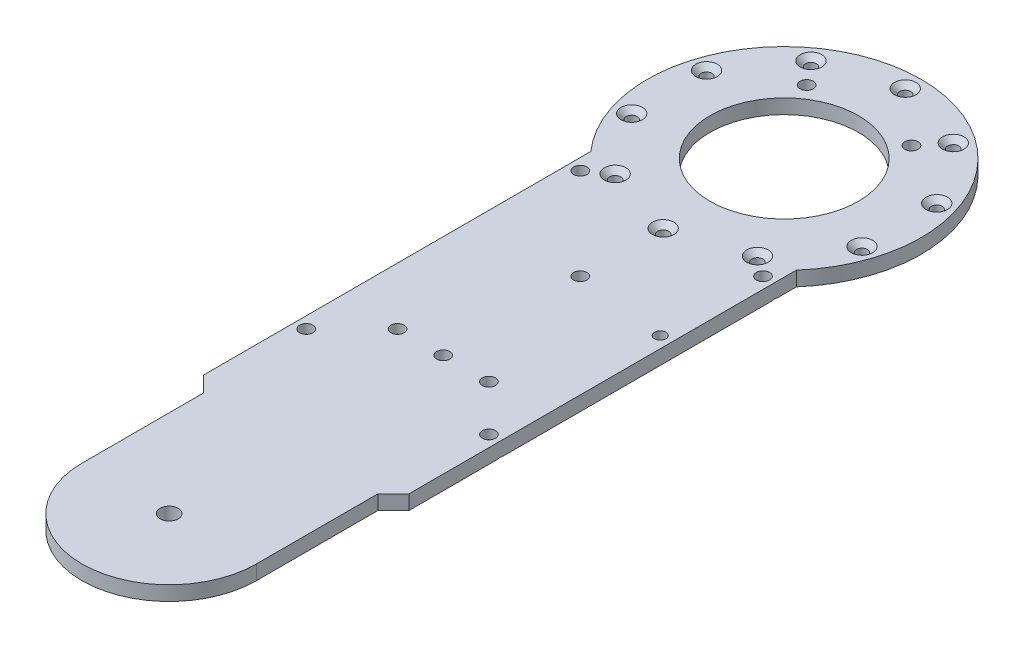
from build123d import *

# Parameters (mm, degrees)
BOSS_EXTRUDE1_DEPTH                             = 6.35
SKETCH2_R                                       = 2
SKETCH2_R_2                                     = 32.5
SKETCH2_R_3                                     = 4
SKETCH2_R_4                                     = 2.5
CUT_EXTRUDE1_DEPTH                              = 314.363323476
CHAMFER1_SIZE                                   = 10
CSK_FOR_M4_OVAL_HEAD_MACHINE_SCREW1_D           = 4.8
CSK_FOR_M4_OVAL_HEAD_MACHINE_SCREW1_CSINK_D     = 9.4
CSK_FOR_M4_OVAL_HEAD_MACHINE_SCREW1_CSINK_ANGLE = 90
CSK_FOR_M5_OVAL_HEAD_MACHINE_SCREW1_D           = 5.8
CSK_FOR_M5_OVAL_HEAD_MACHINE_SCREW1_CSINK_D     = 10.4
CSK_FOR_M5_OVAL_HEAD_MACHINE_SCREW1_CSINK_ANGLE = 90


with BuildPart() as part:
    # Sketch1 → Boss-Extrude1 (new body)
    with BuildSketch(Plane(origin=(0, 0, 0), x_dir=(1, 0, 0), z_dir=(0, 1, 0))):
        with BuildLine():
            Line((-45, -219.3), (-38.2, -219.3))
            Line((-38.2, -219.3), (-38.2, -269.3))
            ThreePointArc((-38.2, -269.3), (0, -307.5), (38.2, -269.3))
            Line((38.2, -269.3), (38.2, -219.3))
            Line((38.2, -219.3), (45, -219.3))
            Line((45, -219.3), (45, -39.686269666))
            ThreePointArc((45, -39.686269666), (0, 60), (-45, -39.686269666))
            Line((-45, -39.686269666), (-45, -219.3))
        make_face()
    extrude(amount=BOSS_EXTRUDE1_DEPTH)

    # Sketch2 → Cut-Extrude1 (cut, through all)
    with BuildSketch(Plane(origin=(0, 6.35, 0), x_dir=(1, 0, 0), z_dir=(0, 1, 0))):
        with Locations(Location((0, 53, 0), (0, 0, 270))):
            Circle(SKETCH2_R)
        with Locations(Location((31.152618372, 42.877900702, 0), (0, 0, 270))):
            Circle(SKETCH2_R)
        with Locations(Location((50.405995364, 16.377900702, 0), (0, 0, 270))):
            Circle(SKETCH2_R)
        with Locations(Location((50.405995364, -16.377900702, 0), (0, 0, 270))):
            Circle(SKETCH2_R)
        with Locations(Location((31.152618372, -42.877900702, 0), (0, 0, 270))):
            Circle(SKETCH2_R)
        with Locations(Location((0, -53, 0), (0, 0, 270))):
            Circle(SKETCH2_R)
        with Locations(Location((-31.152618371, -42.877900702, 0), (0, 0, 270))):
            Circle(SKETCH2_R)
        with Locations(Location((-50.405995364, -16.377900702, 0), (0, 0, 270))):
            Circle(SKETCH2_R)
        with Locations(Location((-50.405995364, 16.377900702, 0), (0, 0, 270))):
            Circle(SKETCH2_R)
        with Locations(Location((-31.152618371, 42.877900702, 0), (0, 0, 270))):
            Circle(SKETCH2_R)
        with Locations(Location((0, 0, 0), (0, 0, 270))):
            Circle(SKETCH2_R_2)
        with Locations(Location((0, -269.3, 0), (0, 0, 270))):
            Circle(SKETCH2_R_3)
        with Locations(Location((-40, -169.3, 0), (0, 0, 270))):
            Circle(SKETCH2_R_4)
        with Locations(Location((-40, -49.3, 0), (0, 0, 270))):
            Circle(SKETCH2_R_4)
        with Locations(Location((40, -169.3, 0), (0, 0, 90))):
            Circle(SKETCH2_R_4)
        with Locations(Location((40, -49.3, 0), (0, 0, 90))):
            Circle(SKETCH2_R_4)
        with Locations(Location((0, -89.3, 0), (0, 0, 270))):
            Circle(SKETCH2_R_4)
        with Locations(Location((-20, -149.3, 0), (0, 0, 270))):
            Circle(SKETCH2_R_4)
        with Locations(Location((0, -149.3, 0), (0, 0, 270))):
            Circle(SKETCH2_R_4)
        with Locations(Location((20, -149.3, 0), (0, 0, 270))):
            Circle(SKETCH2_R_4)
        with Locations(Location((-22.943057454, 32.766081772, 0), (0, 0, 270))):
            Circle(SKETCH2_R_4)
        with Locations(Location((22.943057454, 32.766081772, 0), (0, 0, 270))):
            Circle(SKETCH2_R_4)
        with Locations(Location((40, -94.3, 0), (0, 0, 270))):
            Circle(SKETCH2_R_4)
    extrude(amount=-CUT_EXTRUDE1_DEPTH, mode=Mode.SUBTRACT)

    # Chamfer1
    # the kernel refuses this chamfer: 10 mm, written as the material it takes off along each edge
    with BuildSketch(Plane(origin=(45, -25.71682988, 219.3), x_dir=(0.027495876610586282, 0, -0.9996219169112968), z_dir=(0, 1, 0))) as chamfer1_piece_1_section:
        Polygon((CHAMFER1_SIZE * 0.999621916911, CHAMFER1_SIZE * 0.0274958766106), (-CHAMFER1_SIZE * 0.0274958766106, CHAMFER1_SIZE * 0.999621916911), (0, 0), align=None)
    chamfer1_piece_1 = extrude(amount=57.783659759, mode=Mode.PRIVATE)
    chamfer1_piece_1 = split(chamfer1_piece_1, bisect_by=Plane(origin=(38.2, 3.175, 215.680305009), z_dir=(1, 0, 0)), keep=Keep.TOP, mode=Mode.PRIVATE)
    add(chamfer1_piece_1, mode=Mode.SUBTRACT)
    with BuildSketch(Plane(origin=(-45, -25.71682988, 219.3), x_dir=(-0.027495876610586282, 0, -0.9996219169112968), z_dir=(0, 1, 0))) as chamfer1_piece_2_section:
        Polygon((CHAMFER1_SIZE * 0.999621916911, -CHAMFER1_SIZE * 0.0274958766106), (-CHAMFER1_SIZE * 0.0274958766106, -CHAMFER1_SIZE * 0.999621916911), (0, 0), align=None)
    chamfer1_piece_2 = extrude(amount=57.783659759, mode=Mode.PRIVATE)
    chamfer1_piece_2 = split(chamfer1_piece_2, bisect_by=Plane(origin=(-38.2, 3.175, 215.680305009), z_dir=(-1, 0, 0)), keep=Keep.TOP, mode=Mode.PRIVATE)
    add(chamfer1_piece_2, mode=Mode.SUBTRACT)

    # CSK for M4 Oval Head Machine Screw1 (through all)
    with Locations(Plane(origin=(-50.405995364, 6.35, 16.377900702), x_dir=(0, 0, 1), z_dir=(0, 1, 0))):
        with Locations((0, 0), (-32.755801404, 0), (-59.255801404, 19.253376993), (-69.377900702, 50.405995364), (-59.255801404, 81.558613736), (-32.755801404, 100.811990728), (0, 100.811990728), (26.5, 81.558613736), (36.622099298, 50.405995364), (26.5, 19.253376993)):
            CounterSinkHole(CSK_FOR_M4_OVAL_HEAD_MACHINE_SCREW1_D / 2, CSK_FOR_M4_OVAL_HEAD_MACHINE_SCREW1_CSINK_D / 2, counter_sink_angle=CSK_FOR_M4_OVAL_HEAD_MACHINE_SCREW1_CSINK_ANGLE)

    # CSK for M5 Oval Head Machine Screw1 (through all)
    with Locations(Plane(origin=(22.943057454, 0, -32.766081772), x_dir=(0, 0, -1), z_dir=(0, -1, 0))):
        with Locations((0, 0), (0, -45.886114908), (-122.066081772, -22.943057454), (-82.066081772, 17.056942546), (-82.066081772, -62.943057454), (-202.066081772, -62.943057454), (-202.066081772, 17.056942546), (-182.066081772, -2.943057454), (-182.066081772, -22.943057454), (-182.066081772, -42.943057454)):
            CounterSinkHole(CSK_FOR_M5_OVAL_HEAD_MACHINE_SCREW1_D / 2, CSK_FOR_M5_OVAL_HEAD_MACHINE_SCREW1_CSINK_D / 2, counter_sink_angle=CSK_FOR_M5_OVAL_HEAD_MACHINE_SCREW1_CSINK_ANGLE)


solid = part.part
